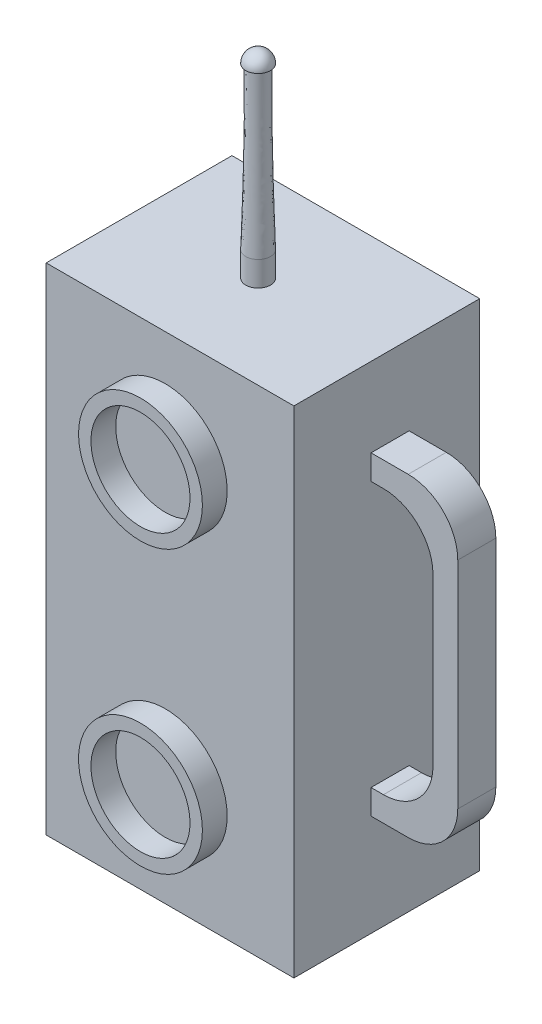
from build123d import *

# Parameters (mm, degrees)
SKETCH1_W           = 10
SKETCH1_H           = 20
BOSS_EXTRUDE1_DEPTH = 7.5
SKETCH2_R           = 2.5
BOSS_EXTRUDE2_DEPTH = 1
SKETCH3_R           = 2
CUT_EXTRUDE1_DEPTH  = 1
SKETCH4_R           = 0.5
BOSS_EXTRUDE3_DEPTH = 1
SKETCH22_W          = 1.536676655
SKETCH22_H          = 12.700180583
BOSS_EXTRUDE4_DEPTH = 3.5
SKETCH25_W          = 2.5
SKETCH25_H          = 10.700180583
CUT_EXTRUDE4_DEPTH  = 5
FILLET1_R           = 2
FILLET2_R           = 2
FILLET3_R           = 2
FILLET4_R           = 2
SKETCH26_W          = 4
SKETCH26_H          = 4
BOSS_EXTRUDE5_DEPTH = 2


with BuildPart() as part:
    # Sketch1 → Boss-Extrude1 (new body)
    with BuildSketch(Plane.XY):
        with Locations((5, 10)):
            Rectangle(SKETCH1_W, SKETCH1_H)
    extrude(amount=BOSS_EXTRUDE1_DEPTH)

    # Sketch2 → Boss-Extrude2 (add)
    with BuildSketch(Plane.XY.offset(7.5)):
        with Locations(Location((4.806301262, 15.681829646, 0), (0, 0, 180))):
            Circle(SKETCH2_R)
    boss_extrude2 = extrude(amount=BOSS_EXTRUDE2_DEPTH)

    # Sketch3 → Cut-Extrude1 (cut)
    with BuildSketch(Plane.XY.offset(8.5)):
        with Locations((4.806301262, 15.681829646)):
            Circle(SKETCH3_R)
    cut_extrude1 = extrude(amount=-CUT_EXTRUDE1_DEPTH, mode=Mode.SUBTRACT)

    # Mirror1: Boss-Extrude2, Cut-Extrude1 across plane
    add(boss_extrude2.mirror(Plane.ZX.offset(10)))
    add(cut_extrude1.mirror(Plane.ZX.offset(10)), mode=Mode.SUBTRACT)

    # Sketch4 → Boss-Extrude3 (add)
    with BuildSketch(Plane(origin=(0, 20, 0), x_dir=(1, 0, 0), z_dir=(0, 1, 0))):
        with Locations(Location((4.806301262, -3.75, 0), (0, 0, 90))):
            Circle(SKETCH4_R)
    extrude(amount=BOSS_EXTRUDE3_DEPTH)

    # Loft1: read off the stored shape, not the designer's step
    # Loft1: loft between two sections, ruled curve by curve
    loft1_from = [
        Edge.make_bspline([(5.062712373, 21, 4.179247414), (5.921207201, 21, 3.666425193), (5.408384979, 21, 2.807930365), (4.549890151, 21, 3.320752586), (3.691395324, 21, 3.833574807), (4.204217545, 21, 4.692069635), (5.062712373, 21, 4.179247414)], [0, 0, 0, 0, 0.5, 0.5, 0.5, 1, 1, 1, 1], 3, [1, 0.333333333, 0.333333333, 1, 0.333333333, 0.333333333, 1]),
    ]
    loft1_to = [
        Edge.make_bspline([(4.701236965, 27.5, 4.1359553), (5.473147564, 27.5, 4.346083894), (5.683276159, 27.5, 3.574173295), (4.911365559, 27.5, 3.3640447), (4.13945496, 27.5, 3.153916106), (3.929326365, 27.5, 3.925826705), (4.701236965, 27.5, 4.1359553)], [0, 0, 0, 0, 0.5, 0.5, 0.5, 1, 1, 1, 1], 3, [1, 0.333333333, 0.333333333, 1, 0.333333333, 0.333333333, 1]),
    ]
    loft1 = Solid(Shell([*[Face.make_surface_from_curves(loft1_from[k], loft1_to[k]) for k in range(1)], Face(Wire(loft1_from)), Face(Wire(loft1_to))]))
    add(loft1)

    # Sketch20 → Revolve1 (revolve)
    with BuildSketch(Plane.XY.offset(3.75), mode=Mode.PRIVATE) as revolve1_sk:
        with BuildLine():
            Line((4.806301262, 28), (4.806301262, 27.5))
            Line((4.806301262, 27.5), (4.306301262, 27.5))
            ThreePointArc((4.306301262, 27.5), (4.452747871, 27.853553391), (4.806301262, 28))
        make_face()
    revolve(revolve1_sk.sketch.rotate(Axis((4.806301262, 28, 3.75), (0, -1, 0)), 180), axis=Axis((4.806301262, 28, 3.75), (0, -1, 0)))

    # Sketch22 → Boss-Extrude4 (add)
    with BuildSketch(Plane(origin=(10, 0, 0), x_dir=(0, 0, -1), z_dir=(1, 0, 0))):
        with Locations((-3.61725079, 10.452084784)):
            Rectangle(SKETCH22_W, SKETCH22_H)
    extrude(amount=BOSS_EXTRUDE4_DEPTH)

    # Sketch25 → Cut-Extrude4 (cut)
    with BuildSketch(Plane.XY.offset(4.385589117)):
        with Locations((11.25, 10.452084784)):
            Rectangle(SKETCH25_W, SKETCH25_H)
    extrude(amount=-CUT_EXTRUDE4_DEPTH, mode=Mode.SUBTRACT)

    # Fillet1
    fillet1_edges = [part.edges().sort_by_distance(p)[0] for p in [
        (13.5, 16.802175075, 3.617250789),
    ]]
    fillet(fillet1_edges, radius=FILLET1_R)

    # Fillet2
    fillet2_edges = [part.edges().sort_by_distance(p)[0] for p in [
        (12.5, 15.802175075, 3.617250789),
    ]]
    fillet(fillet2_edges, radius=FILLET2_R)

    # Fillet3
    fillet3_edges = [part.edges().sort_by_distance(p)[0] for p in [
        (13.5, 4.101994492, 3.617250789),
    ]]
    fillet(fillet3_edges, radius=FILLET3_R)

    # Fillet4
    fillet4_edges = [part.edges().sort_by_distance(p)[0] for p in [
        (12.5, 5.101994492, 3.617250789),
    ]]
    fillet(fillet4_edges, radius=FILLET4_R)

    # Sketch26 → Boss-Extrude5 (add)
    with BuildSketch(Plane(origin=(0, 0, 0), x_dir=(-1, 0, 0), z_dir=(0, 0, -1))):
        with Locations((-4.478821767, 10.486042594)):
            Rectangle(SKETCH26_W, SKETCH26_H)
    extrude(amount=BOSS_EXTRUDE5_DEPTH)


solid = part.part
